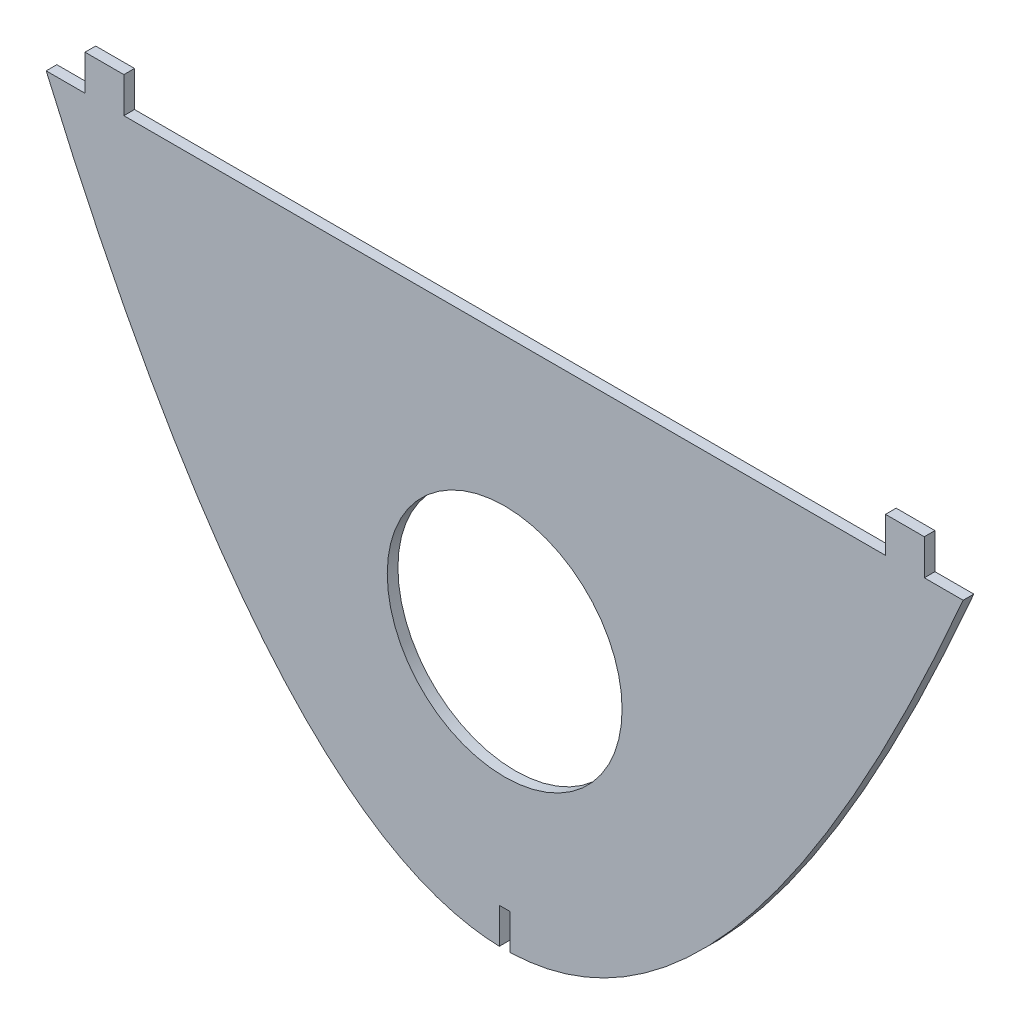
from build123d import *

# Parameters (mm, degrees)
BOSS_EXTRUDE1_DEPTH     = 3
CUT_EXTRUDE1_DEPTH      = 178.489474922
CUT_EXTRUDE1_DEPTH_BACK = 178.489474922
CUT_EXTRUDE3_DEPTH      = 178.489474922
CUT_EXTRUDE3_DEPTH_BACK = 178.489474922
SKETCH3_R               = 33


with BuildPart() as part:
    # Sketch1 → Boss-Extrude1 (new body)
    with BuildSketch(Plane.XY):
        with BuildLine():
            Line((117.938118169, 112.027561489), (128.851805939, 112.027561489))
            add(Edge.make_bspline(
                [(-128.851805935, 112.027561492), (1.4e-08, -186.82262059), (128.851805939, 112.027561489)],
                knots=[0.209657911, 0.209657911, 0.209657911, 0.790342089, 0.790342089, 0.790342089], degree=2))
            Line((-128.851805935, 112.027561492), (-117.938118165, 112.027561492))
            Line((-117.938118165, 112.027561492), (-117.938118165, 122.027561492))
            Line((-117.938118165, 122.027561492), (-107.024430394, 122.027561492))
            Line((-107.024430394, 122.027561492), (-107.024430394, 112.027561492))
            Line((-107.024430394, 112.027561492), (107.0244304, 112.027561492))
            Line((107.0244304, 112.027561492), (107.0244304, 122.027561492))
            Line((107.0244304, 122.027561492), (117.938118169, 122.027561492))
            Line((117.938118169, 122.027561492), (117.938118169, 112.027561489))
        make_face()
    extrude(amount=BOSS_EXTRUDE1_DEPTH)

    # Sketch2 → Cut-Extrude1 (cut, two sides: drawn at the far end of the back side and taken through both)
    with BuildSketch(Plane.XY.offset(-CUT_EXTRUDE1_DEPTH_BACK)):
        Polygon((5e-09, -37.397529544), (-1.499999995, -37.397529543), (-1.499999995, -27.397529543), (1.500000005, -27.397529543), (1.500000005, -37.397529543), align=None)
    extrude(amount=CUT_EXTRUDE1_DEPTH + CUT_EXTRUDE1_DEPTH_BACK, mode=Mode.SUBTRACT)

    # Sketch3 → Cut-Extrude3 (cut, two sides: drawn at the far end of the back side and taken through both)
    with BuildSketch(Plane.XY.offset(-CUT_EXTRUDE3_DEPTH_BACK)):
        with Locations((0, 37.563031492)):
            Circle(SKETCH3_R)
    extrude(amount=CUT_EXTRUDE3_DEPTH + CUT_EXTRUDE3_DEPTH_BACK, mode=Mode.SUBTRACT)


solid = part.part
